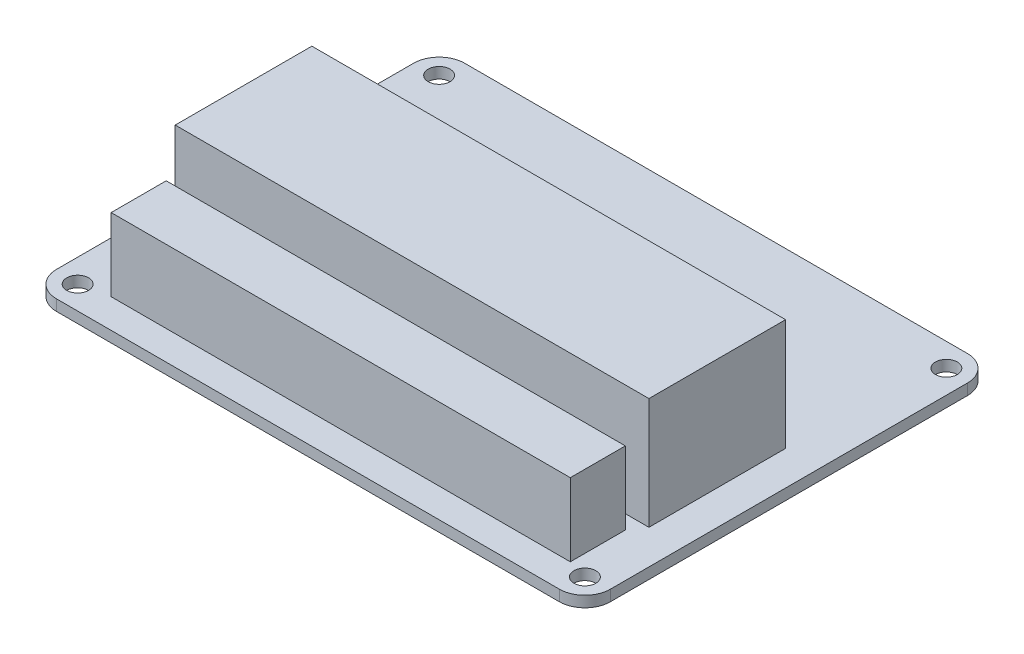
from build123d import *

# Parameters (mm, degrees)
SKETCH1_R           = 1.5
BOSS_EXTRUDE1_DEPTH = 1.5
FILLET1_R           = 3.5
SKETCH3_W           = 63
SKETCH3_H           = 7.55
BOSS_EXTRUDE3_DEPTH = 10
SKETCH4_W           = 65
SKETCH4_H           = 18.75
BOSS_EXTRUDE4_DEPTH = 15.3


with BuildPart() as part:
    # Sketch1 → Boss-Extrude1 (new body)
    with BuildSketch(Plane(origin=(0, 0, 0), x_dir=(1, 0, 0), z_dir=(0, 1, 0))):
        Polygon((76, -56), (76, -28), (76, 0), (0, 0), (0, -56), align=None)
        with Locations((72.8, -52.8)):
            Circle(SKETCH1_R, mode=Mode.SUBTRACT)
        with Locations((72.8, -3.2)):
            Circle(SKETCH1_R, mode=Mode.SUBTRACT)
        with Locations((3.2, -52.8)):
            Circle(SKETCH1_R, mode=Mode.SUBTRACT)
        with Locations((3.2, -3.2)):
            Circle(SKETCH1_R, mode=Mode.SUBTRACT)
    extrude(amount=BOSS_EXTRUDE1_DEPTH)

    # Fillet1
    fillet1_edges = [part.edges().sort_by_distance(p)[0] for p in [
        (76, 0.75, 0),
        (76, 0.75, 56),
        (0, 0.75, 56),
        (0, 0.75, 0),
    ]]
    fillet(fillet1_edges, radius=FILLET1_R)

    # Sketch3 → Boss-Extrude3 (add)
    with BuildSketch(Plane(origin=(0, 1.5, 0), x_dir=(1, 0, 0), z_dir=(0, 1, 0))):
        with Locations((38.5, -48.225)):
            Rectangle(SKETCH3_W, SKETCH3_H)
    extrude(amount=BOSS_EXTRUDE3_DEPTH)

    # Sketch4 → Boss-Extrude4 (add)
    with BuildSketch(Plane(origin=(0, 1.5, 0), x_dir=(1, 0, 0), z_dir=(0, 1, 0))):
        with Locations((38.794123638, -33.130364422)):
            Rectangle(SKETCH4_W, SKETCH4_H)
    extrude(amount=BOSS_EXTRUDE4_DEPTH)


solid = part.part
